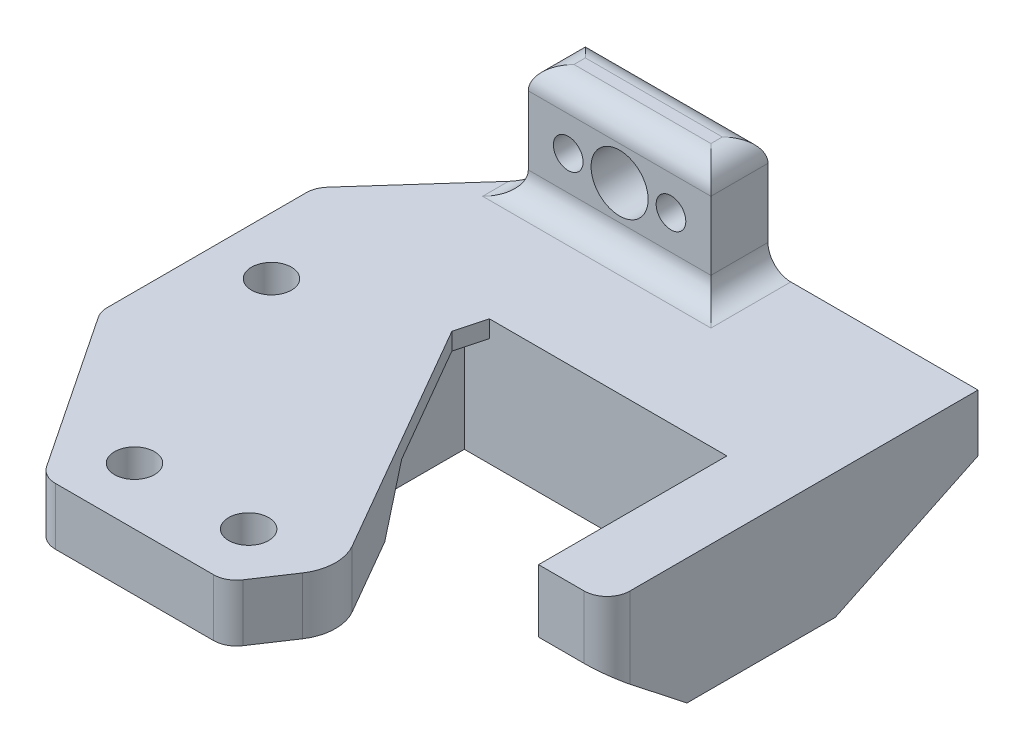
from build123d import *

# Parameters (mm, degrees)
SKETCH1_R                = 1.75
SKETCH1_W                = 7.2
SKETCH1_H                = 5.4
BOSS_EXTRUDE1_DEPTH      = 5
FILLET5_RADIUS           = 10
FILLET5_LENGTH           = 5
FILLET2_R                = 5.4
FILLET6_R                = 5.4
SKETCH3_W                = 35
SKETCH3_H                = 20
SKETCH3_W_2              = 23
SKETCH3_H_2              = 13
BOSS_EXTRUDE4_DEPTH      = 6
SKETCH5_W                = 23
SKETCH5_H                = 13
CUT_EXTRUDE1_DEPTH       = 3.5
CUT_EXTRUDE2_DEPTH       = 76.239617224
SKETCH9_R                = 1
CUT_EXTRUDE4_DEPTH       = 7
BOSS_EXTRUDE5_DEPTH      = 2.5
BOSS_EXTRUDE5_DEPTH_BACK = 2.5
SKETCH10_W               = 16
SKETCH10_H               = 15
SKETCH11_R               = 2.5
SKETCH11_R_2             = 1.3
CUT_EXTRUDE5_DEPTH       = 64.2661837
FILLET8_R                = 2
BOSS_EXTRUDE10_DEPTH     = 35
SKETCH13_W               = 23
SKETCH13_H               = 9.5
CUT_EXTRUDE6_DEPTH       = 3.5
CUT_EXTRUDE7_REACH       = 68.728
BOSS_EXTRUDE11_DEPTH     = 20.6
FILLET9_R                = 2
FILLET10_R               = 2
CUT_EXTRUDE9_DEPTH       = 67.029236021
CUT_EXTRUDE9_DEPTH_BACK  = 67.029236021
FILLET11_R               = 4
CHAMFER1_SIZE            = 3
CHAMFER1_SIZE2           = 2.196152423


# Read off the part's stored shape, not the designer's step: Boss-Extrude11
with BuildPart() as part:
    # Sketch1 → Boss-Extrude1 (new body)
    # profile 1 of 4: a face of its own
    with BuildSketch(Plane(origin=(0, 0, 0), x_dir=(1, 0, 0), z_dir=(0, 1, 0))):
        with BuildLine():
            Line((3.25, 25), (0, 25))
            Line((0, 25), (0, 15))
            Line((0, 15), (10, 0))
            Line((10, 0), (26, 0))
            Line((26, 0), (36, 15))
            Line((36, 15), (60, 15))
            Line((60, 15), (60, 25))
            Line((60, 25), (44.5, 25))
            Line((44.5, 25), (44.5, 19.6))
            Line((44.5, 19.6), (37.3, 19.6))
            Line((37.3, 19.6), (26.5, 19.6))
            Line((26.5, 19.6), (26.5, 25))
            Line((26.5, 25), (6.75, 25))
            ThreePointArc((6.75, 25), (5, 23.25), (3.25, 25))
        make_face()
        with Locations(Location((13, 5, 0), (0, 0, 270))):
            Circle(SKETCH1_R, mode=Mode.SUBTRACT)
        with Locations(Location((23, 5, 0), (0, 0, 270))):
            Circle(SKETCH1_R, mode=Mode.SUBTRACT)
    # profile 2 of 4: a face of its own
    with BuildSketch(Plane(origin=(0, 0, 0), x_dir=(1, 0, 0), z_dir=(0, 1, 0))):
        with BuildLine():
            Line((10, 45), (0, 33.819660113))
            Line((0, 33.819660113), (0, 25))
            Line((0, 25), (3.25, 25))
            ThreePointArc((3.25, 25), (5, 26.75), (6.75, 25))
            Line((6.75, 25), (26.5, 25))
            Line((26.5, 25), (26.5, 30.4))
            Line((26.5, 30.4), (37.3, 30.4))
            Line((37.3, 30.4), (44.5, 30.4))
            Line((44.5, 30.4), (44.5, 25))
            Line((44.5, 25), (60, 25))
            Line((60, 25), (60, 35))
            Line((60, 35), (36, 35))
            Line((36, 35), (26, 45))
            Line((26, 45), (10, 45))
        make_face()
    # profile 3 of 4: a face of its own
    with BuildSketch(Plane(origin=(0, 0, 0), x_dir=(1, 0, 0), z_dir=(0, 1, 0))):
        with Locations((40.9, 27.7)):
            Rectangle(SKETCH1_W, SKETCH1_H)
    # profile 4 of 4: a face of its own
    with BuildSketch(Plane(origin=(0, 0, 0), x_dir=(1, 0, 0), z_dir=(0, 1, 0))):
        with Locations((40.9, 22.3)):
            Rectangle(SKETCH1_W, SKETCH1_H)
    extrude(amount=BOSS_EXTRUDE1_DEPTH)

    # Fillet5: full round fillet: the end face becomes a half cylinder, R = half its width
    fillet5_face = Plane((60, 2.5, -25), x_dir=(0, -1, 0), z_dir=(1, 0, 0))  # on the end face: x along it, z out of the body
    fillet5_slab = fillet5_face.offset(-FILLET5_RADIUS / 2) * Box(FILLET5_LENGTH, 2 * FILLET5_RADIUS, FILLET5_RADIUS, mode=Mode.PRIVATE)  # the body's end, R deep
    fillet5_round = Plane((50, 2.5, -25), x_dir=(1, 0, 0), z_dir=(0, -1, 0)) * Cylinder(FILLET5_RADIUS, FILLET5_LENGTH, mode=Mode.PRIVATE)  # its axis R under the face
    add(fillet5_slab - fillet5_round, mode=Mode.SUBTRACT)

    # Fillet2
    fillet2_edges = [part.edges().sort_by_distance(p)[0] for p in [
        (26.5, 2.5, -30.4),
        (26.5, 2.5, -19.6),
    ]]
    fillet(fillet2_edges, radius=FILLET2_R - 0.0001)  # a hair under: the kernel refuses the full size

    # Fillet6
    fillet6_edges = [part.edges().sort_by_distance(p)[0] for p in [
        (37.3, 2.5, -19.6),
        (37.3, 2.5, -30.4),
    ]]
    fillet(fillet6_edges, radius=FILLET6_R - 0.0001)  # a hair under: the kernel refuses the full size

    # Sketch3 → Boss-Extrude4 (add)
    with BuildSketch(Plane.XZ):
        with Locations((26.9, -25)):
            Rectangle(SKETCH3_W, SKETCH3_H)
        with Locations((26.9, -25)):
            Rectangle(SKETCH3_W_2, SKETCH3_H_2, mode=Mode.SUBTRACT)
    extrude(amount=BOSS_EXTRUDE4_DEPTH)

    # Sketch5 → Cut-Extrude1 (cut)
    with BuildSketch(Plane.XZ):
        with Locations((26.9, -25)):
            Rectangle(SKETCH5_W, SKETCH5_H)
    extrude(amount=-CUT_EXTRUDE1_DEPTH, mode=Mode.SUBTRACT)

    # Sketch6 → Cut-Extrude2 (cut, through all)
    with BuildSketch(Plane.XZ):
        with BuildLine():
            Line((44.4, -15), (44.4, -35))
            Line((44.4, -35), (50, -35))
            ThreePointArc((50, -35), (60, -25), (50, -15))
            Line((50, -15), (44.4, -15))
        make_face()
    extrude(amount=-CUT_EXTRUDE2_DEPTH, mode=Mode.SUBTRACT)

    # Sketch9 → Cut-Extrude4 (cut)
    with BuildSketch(Plane.XZ.offset(6)):
        with Locations(Location((13.1, -25, 0), (0, 0, 270))):
            Circle(SKETCH9_R)
        with Locations(Location((40.7, -25, 0), (0, 0, 270))):
            Circle(SKETCH9_R)
    extrude(amount=-CUT_EXTRUDE4_DEPTH, mode=Mode.SUBTRACT)

    # Sketch10 → Boss-Extrude5 (add, two sides: drawn at the far end of the back side and taken through both)
    with BuildSketch(Plane(origin=(0, 0, -45), x_dir=(-1, 0, 0), z_dir=(0, 0, -1)).offset(-BOSS_EXTRUDE5_DEPTH_BACK)):
        with Locations((-18, 7.5)):
            Rectangle(SKETCH10_W, SKETCH10_H)
    extrude(amount=BOSS_EXTRUDE5_DEPTH + BOSS_EXTRUDE5_DEPTH_BACK)

    # Sketch11 → Cut-Extrude5 (cut, through all)
    with BuildSketch(Plane.XY.offset(-42.5)):
        with Locations((18, 10)):
            Circle(SKETCH11_R)
        with Locations((22.5, 10)):
            Circle(SKETCH11_R_2)
        with Locations((13.5, 10)):
            Circle(SKETCH11_R_2)
    extrude(amount=-CUT_EXTRUDE5_DEPTH, mode=Mode.SUBTRACT)

    # Fillet8
    fillet8_edges = [part.edges().sort_by_distance(p)[0] for p in [
        (26, 15, -45),
        (18, 15, -42.5),
        (10, 15, -45),
        (18, 15, -47.5),
    ]]
    fillet(fillet8_edges, radius=FILLET8_R)

    # Sketch12 → Boss-Extrude10 (add)
    with BuildSketch(Plane(origin=(44.4, 0, 0), x_dir=(0, 0, -1), z_dir=(1, 0, 0))):
        Polygon((35, -6), (35, 5), (47.5, 5), (47.5, 0), align=None)
    extrude(amount=-BOSS_EXTRUDE10_DEPTH)

    # Sketch13 → Cut-Extrude6 (cut)
    with BuildSketch(Plane(origin=(0, 0, -18.5), x_dir=(-1, 0, 0), z_dir=(0, 0, -1))):
        with Locations((-26.9, -1.25)):
            Rectangle(SKETCH13_W, SKETCH13_H)
    extrude(amount=-CUT_EXTRUDE6_DEPTH, mode=Mode.SUBTRACT)

    # Cut-Extrude7: up to this face of the body (flat: up to its plane)
    cut_extrude7_end = Plane(part.part.faces().sort_by_distance((9.4, -2.280677184, -29.977280777))[0])
    # Sketch14 → Cut-Extrude7 (cut, up to the picked face)
    with BuildSketch(Plane(origin=(44.4, 0, 0), x_dir=(0, 0, -1), z_dir=(1, 0, 0)), mode=Mode.PRIVATE) as cut_extrude7_sk1:
        Polygon((15, -0.5), (22, -6), (15, -6), align=None)
    cut_extrude7_tool1 = split(extrude(cut_extrude7_sk1.sketch, amount=-CUT_EXTRUDE7_REACH, mode=Mode.PRIVATE), bisect_by=cut_extrude7_end, keep=Keep.BOTH, mode=Mode.PRIVATE)
    add(cut_extrude7_tool1.solids().sort_by(Axis((44.4, -4.166667, -17.333333), (-1, 0, 0)))[0], mode=Mode.SUBTRACT)

    # Boss-Extrude11 outline → Boss-Extrude11 (add)
    with BuildSketch(Plane(origin=(15.4, 0, 0), x_dir=(0, 0, -1), z_dir=(1, 0, 0))):
        Polygon((15, 0), (18.5, 3.5), (15, 3.5), align=None)
    extrude(amount=BOSS_EXTRUDE11_DEPTH)

    # Fillet9
    fillet9_edges = [part.edges().sort_by_distance(p)[0] for p in [
        (9.4, 2.5, -44.329179607),
        (44.4, 2.25, -15),
        (36, 4.25, -15),
        (26, 2.5, 0),
        (10, 2.5, 0),
        (0, 2.5, -15),
        (0, 2.5, -33.819660113),
    ]]
    fillet(fillet9_edges, radius=FILLET9_R)

    # Fillet10
    fillet10_edges = [part.edges().sort_by_distance(p)[0] for p in [
        (10, 5, -45),
        (26, 5, -45),
        (18, 5, -42.5),
    ]]
    fillet(fillet10_edges, radius=FILLET10_R)

    # Sketch18 → Cut-Extrude9 (cut, two sides: drawn at the far end of the back side and taken through both)
    with BuildSketch(Plane.XZ.offset(-3.5).offset(-CUT_EXTRUDE9_DEPTH_BACK)):
        Polygon((15.4, -31.5), (38.4, -31.5), (38.4, 8.337168574), align=None)
    extrude(amount=CUT_EXTRUDE9_DEPTH + CUT_EXTRUDE9_DEPTH_BACK, mode=Mode.SUBTRACT)

    # Fillet11
    fillet11_edges = [part.edges().sort_by_distance(p)[0] for p in [
        (30.065611038, 2.5, -6.098416558),
    ]]
    fillet(fillet11_edges, radius=FILLET11_R)

    # Chamfer1
    chamfer1_edges = [part.edges().sort_by_distance(p)[0] for p in [
        (15.4, 4.25, -31.5),
    ]]
    chamfer1_side = [part.faces().sort_by_distance(p)[0] for p in [
        (24.055872114, 3.154417612, -16.507589715),
    ]]
    chamfer(chamfer1_edges, length=CHAMFER1_SIZE, length2=CHAMFER1_SIZE2, reference=chamfer1_side[0])


solid = part.part
